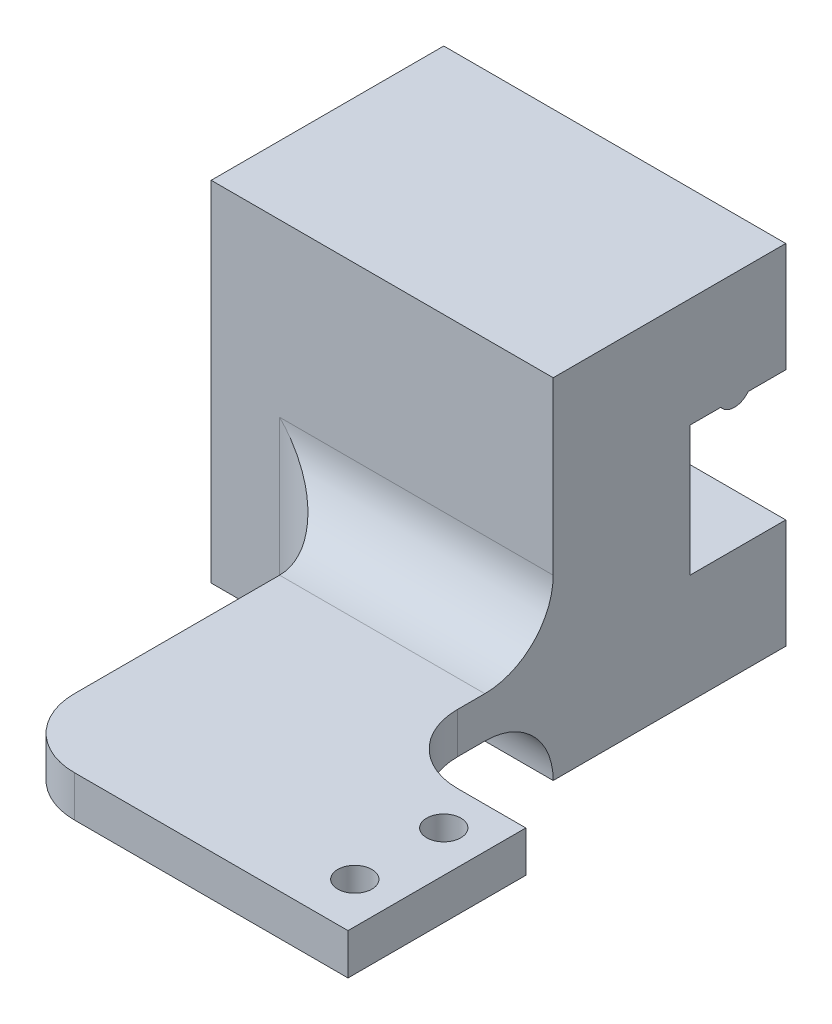
from build123d import *

# Parameters (mm, degrees)
BOSS_EXTRUDE1_DEPTH = 50
SKETCH2_W           = 7
SKETCH2_H           = 8
BOSS_EXTRUDE2_DEPTH = 50
SKETCH2_3_W         = 7
SKETCH2_3_H         = 8
BOSS_EXTRUDE3_DEPTH = 18
SKETCH3_W           = 10
SKETCH3_H           = 63
SKETCH3_W_2         = 7
SKETCH3_H_2         = 8
BOSS_EXTRUDE4_DEPTH = 82
FILLET1_R           = 5
SKETCH4_W           = 49
SKETCH4_H           = 25.5
CUT_EXTRUDE1_DEPTH  = 63
SKETCH5_W           = 25.5
SKETCH5_H           = 10
SKETCH5_H_2         = 12
BOSS_EXTRUDE5_DEPTH = 49
CUT_EXTRUDE2_DEPTH  = 25.5
SKETCH6_R           = 1.75
CUT_EXTRUDE3_DEPTH  = 5
SKETCH6_6_R         = 0.75
CUT_EXTRUDE4_DEPTH  = 15
SKETCH8_W           = 18
SKETCH8_H           = 9.5
CUT_EXTRUDE5_DEPTH  = 40
SKETCH9_W           = 40
SKETCH9_H           = 25.5
CUT_EXTRUDE6_DEPTH  = 110.982953225
SKETCH10_W          = 32
SKETCH10_H          = 88.5
CUT_EXTRUDE7_DEPTH  = 111.174861016
SKETCH11_W          = 50
SKETCH11_H          = 63
CUT_EXTRUDE8_DEPTH  = 105.797423632
SKETCH12_W          = 25.5
SKETCH12_H          = 35
BOSS_EXTRUDE7_DEPTH = 10
SKETCH12_3_R        = 10
CUT_EXTRUDE9_DEPTH  = 107.716915248
SKETCH13_W          = 42.5
SKETCH13_H          = 88.5
CUT_EXTRUDE10_DEPTH = 25
SKETCH14_W          = 25
SKETCH14_H          = 28
CUT_EXTRUDE11_DEPTH = 96.433222727
SKETCH15_W          = 25
SKETCH15_H          = 60.5
CUT_EXTRUDE12_DEPTH = 71.25311381
SKETCH16_W          = 10
SKETCH16_H          = 35
CUT_EXTRUDE13_DEPTH = 68.633201906
SKETCH17_W          = 15
SKETCH17_H          = 35
BOSS_EXTRUDE8_DEPTH = 3
BOSS_EXTRUDE9_DEPTH = 10
SKETCH19_R          = 1.25
CUT_EXTRUDE14_DEPTH = 54.574714185
FILLET4_R           = 5


with BuildPart() as part:
    # Sketch1 → Boss-Extrude1 (new body)
    with BuildSketch(Plane.XY):
        with BuildLine():
            Line((-2.25, -8), (-4.25, -8))
            ThreePointArc((-4.25, -8), (-3.25, -8.5), (-2.25, -8))
        make_face()
        Polygon((10, -25.5), (10, 0), (0, 0), (-18, 0), (-18, -8), (0, -8), (0, -17.5), (-18, -17.5), (-18, -25.5), align=None)
    extrude(amount=BOSS_EXTRUDE1_DEPTH)

    # Sketch2 → Boss-Extrude2 (add)
    with BuildSketch(Plane(origin=(0, 0, 0), x_dir=(0, 0, -1), z_dir=(1, 0, 0))):
        Polygon((7, 0), (0, 0), (0, -8), (2.25, -8), (4.25, -8), (7, -8), align=None)
        Polygon((0, -8), (0, 0), (-10, 0), (-10, -25.5), (0, -25.5), (0, -17.5), align=None)
        with Locations((3.5, -21.5)):
            Rectangle(SKETCH2_W, SKETCH2_H)
        with BuildLine():
            Line((4.25, -8), (2.25, -8))
            ThreePointArc((2.25, -8), (3.25, -8.5), (4.25, -8))
        make_face()
    extrude(amount=BOSS_EXTRUDE2_DEPTH)

    # Sketch2<3> → Boss-Extrude3 (add)
    with BuildSketch(Plane(origin=(0, 0, 0), x_dir=(0, 0, -1), z_dir=(1, 0, 0))):
        Polygon((7, 0), (0, 0), (0, -8), (2.25, -8), (4.25, -8), (7, -8), align=None)
        with Locations((3.5, -21.5)):
            Rectangle(SKETCH2_3_W, SKETCH2_3_H)
    extrude(amount=-BOSS_EXTRUDE3_DEPTH)

    # Sketch3 → Boss-Extrude4 (add)
    with BuildSketch(Plane(origin=(50, 0, 0), x_dir=(0, 0, -1), z_dir=(1, 0, 0))):
        Polygon((32.5, -17.5), (7, -17.5), (7, -25.5), (0, -25.5), (0, -88.5), (32.5, -88.5), align=None)
        with Locations((-5, -57)):
            Rectangle(SKETCH3_W, SKETCH3_H)
        with Locations((3.5, -21.5)):
            Rectangle(SKETCH3_W_2, SKETCH3_H_2)
        with Locations((-5, -21.5)):
            Rectangle(SKETCH3_W, SKETCH3_H_2)
    extrude(amount=-BOSS_EXTRUDE4_DEPTH)

    # Fillet1
    fillet1_edges = [part.edges().sort_by_distance(p)[0] for p in [
        (-32, -17.5, -11.25),
        (-32, -53, -32.5),
        (9, -17.5, -32.5),
    ]]
    fillet(fillet1_edges, radius=FILLET1_R)

    # Sketch4 → Cut-Extrude1 (cut)
    with BuildSketch(Plane.XZ.offset(88.5)):
        with Locations((25.5, -2.75)):
            Rectangle(SKETCH4_W, SKETCH4_H)
    extrude(amount=-CUT_EXTRUDE1_DEPTH, mode=Mode.SUBTRACT)

    # Sketch5 → Boss-Extrude5 (add)
    with BuildSketch(Plane(origin=(50, 0, 0), x_dir=(0, 0, -1), z_dir=(1, 0, 0))):
        with Locations((2.75, -30.5)):
            Rectangle(SKETCH5_W, SKETCH5_H)
        with Locations((2.75, -82.5)):
            Rectangle(SKETCH5_W, SKETCH5_H_2)
    extrude(amount=-BOSS_EXTRUDE5_DEPTH)

    # Sketch7 → Cut-Extrude2 (cut)
    with BuildSketch(Plane.XY.offset(10)):
        Polygon((1, -35.5), (27, -35.5), (27, -25.5), (50, -25.5), (50, -88.5), (27, -88.5), (27, -76.5), (1, -76.5), align=None)
    extrude(amount=-CUT_EXTRUDE2_DEPTH, mode=Mode.SUBTRACT)

    # Sketch6 → Cut-Extrude3 (cut)
    with BuildSketch(Plane(origin=(27, 0, 0), x_dir=(0, 0, -1), z_dir=(1, 0, 0))):
        with Locations((0.25, -81.5)):
            Circle(SKETCH6_R)
        with Locations((10.25, -81.5)):
            Circle(SKETCH6_R)
        with Locations((10.25, -32.5)):
            Circle(SKETCH6_R)
        with Locations((0.25, -32.5)):
            Circle(SKETCH6_R)
    extrude(amount=-CUT_EXTRUDE3_DEPTH, mode=Mode.SUBTRACT)

    # Sketch6<6> → Cut-Extrude4 (cut)
    with BuildSketch(Plane(origin=(27, 0, 0), x_dir=(0, 0, -1), z_dir=(1, 0, 0))):
        with Locations((0.25, -81.5)):
            Circle(SKETCH6_6_R)
        with Locations((10.25, -81.5)):
            Circle(SKETCH6_6_R)
        with Locations((10.25, -32.5)):
            Circle(SKETCH6_6_R)
        with Locations((0.25, -32.5)):
            Circle(SKETCH6_6_R)
    extrude(amount=-CUT_EXTRUDE4_DEPTH, mode=Mode.SUBTRACT)

    # Sketch8 → Cut-Extrude5 (cut)
    with BuildSketch(Plane(origin=(0, 0, -7), x_dir=(-1, 0, 0), z_dir=(0, 0, -1))):
        with Locations((9, -12.75)):
            Rectangle(SKETCH8_W, SKETCH8_H)
    extrude(amount=-CUT_EXTRUDE5_DEPTH, mode=Mode.SUBTRACT)

    # Sketch9 → Cut-Extrude6 (cut, through all)
    with BuildSketch(Plane(origin=(10, 0, 0), x_dir=(0, 0, -1), z_dir=(1, 0, 0))):
        with Locations((-30, -12.75)):
            Rectangle(SKETCH9_W, SKETCH9_H)
    extrude(amount=-CUT_EXTRUDE6_DEPTH, mode=Mode.SUBTRACT)

    # Sketch10 → Cut-Extrude7 (cut, through all)
    with BuildSketch(Plane.XY.offset(10)):
        with Locations((-16, -44.25)):
            Rectangle(SKETCH10_W, SKETCH10_H)
    extrude(amount=-CUT_EXTRUDE7_DEPTH, mode=Mode.SUBTRACT)

    # Sketch11 → Cut-Extrude8 (cut, through all)
    with BuildSketch(Plane.XY.offset(-15.5)):
        with Locations((25, -57)):
            Rectangle(SKETCH11_W, SKETCH11_H)
    extrude(amount=CUT_EXTRUDE8_DEPTH, mode=Mode.SUBTRACT)

    # Sketch12 → Boss-Extrude7 (add)
    with BuildSketch(Plane.ZY):
        with Locations((-2.75, -43)):
            Rectangle(SKETCH12_W, SKETCH12_H)
    extrude(amount=-BOSS_EXTRUDE7_DEPTH)

    # Sketch12<3> → Cut-Extrude9 (cut, through all)
    with BuildSketch(Plane.ZY):
        with Locations(Location((-5.5, -42.5, 0), (0, 0, 270))):
            Circle(SKETCH12_3_R)
    extrude(amount=-CUT_EXTRUDE9_DEPTH, mode=Mode.SUBTRACT)

    # Sketch13 → Cut-Extrude10 (cut)
    with BuildSketch(Plane(origin=(50, 0, 0), x_dir=(0, 0, -1), z_dir=(1, 0, 0))):
        with Locations((11.25, -44.25)):
            Rectangle(SKETCH13_W, SKETCH13_H)
    extrude(amount=-CUT_EXTRUDE10_DEPTH, mode=Mode.SUBTRACT)

    # Sketch14 → Cut-Extrude11 (cut, through all)
    with BuildSketch(Plane.XY.offset(-15.5)):
        with Locations((12.5, -74.5)):
            Rectangle(SKETCH14_W, SKETCH14_H)
    extrude(amount=-CUT_EXTRUDE11_DEPTH, mode=Mode.SUBTRACT)

    # Sketch15 → Cut-Extrude12 (cut, through all)
    with BuildSketch(Plane(origin=(0, 0, -7), x_dir=(-1, 0, 0), z_dir=(0, 0, -1))):
        with Locations((-12.5, -30.25)):
            Rectangle(SKETCH15_W, SKETCH15_H)
    extrude(amount=CUT_EXTRUDE12_DEPTH, mode=Mode.SUBTRACT)

    # Sketch16 → Cut-Extrude13 (cut, through all)
    with BuildSketch(Plane(origin=(0, 0, -7), x_dir=(-1, 0, 0), z_dir=(0, 0, -1))):
        with Locations((-5, -43)):
            Rectangle(SKETCH16_W, SKETCH16_H)
    extrude(amount=-CUT_EXTRUDE13_DEPTH, mode=Mode.SUBTRACT)

    # Sketch17 → Boss-Extrude8 (add)
    with BuildSketch(Plane(origin=(0, -17.5, 0), x_dir=(1, 0, 0), z_dir=(0, 1, 0))):
        with Locations((17.5, -17.5)):
            Rectangle(SKETCH17_W, SKETCH17_H)
    extrude(amount=-BOSS_EXTRUDE8_DEPTH)

    # Sketch18 → Boss-Extrude9 (add)
    with BuildSketch(Plane(origin=(25, 0, 0), x_dir=(0, 0, -1), z_dir=(1, 0, 0))):
        Polygon((-10, -17.5), (-35, -17.5), (-35, -20.5), (-10, -20.5), (0, -20.5), (0, -17.5), align=None)
    extrude(amount=BOSS_EXTRUDE9_DEPTH)

    # Sketch19 → Cut-Extrude14 (cut, through all)
    with BuildSketch(Plane.XZ.offset(20.5)):
        Polygon((35, 0), (35, 22), (25, 22), (25, 10), (25, 0), align=None)
        with Locations(Location((32, 25, 0), (0, 0, 270))):
            Circle(SKETCH19_R)
        with Locations(Location((32, 31.5, 0), (0, 0, 270))):
            Circle(SKETCH19_R)
    extrude(amount=-CUT_EXTRUDE14_DEPTH, mode=Mode.SUBTRACT)

    # Fillet4
    fillet4_edges = [part.edges().sort_by_distance(p)[0] for p in [
        (10, -19, 10),
        (17.5, -20.5, 10),
        (10, -19, 35),
        (17.5, -17.5, 10),
        (25, -19, 22),
    ]]
    fillet(fillet4_edges, radius=FILLET4_R - 0.0001)  # a hair under: the kernel refuses the full size


solid = part.part
